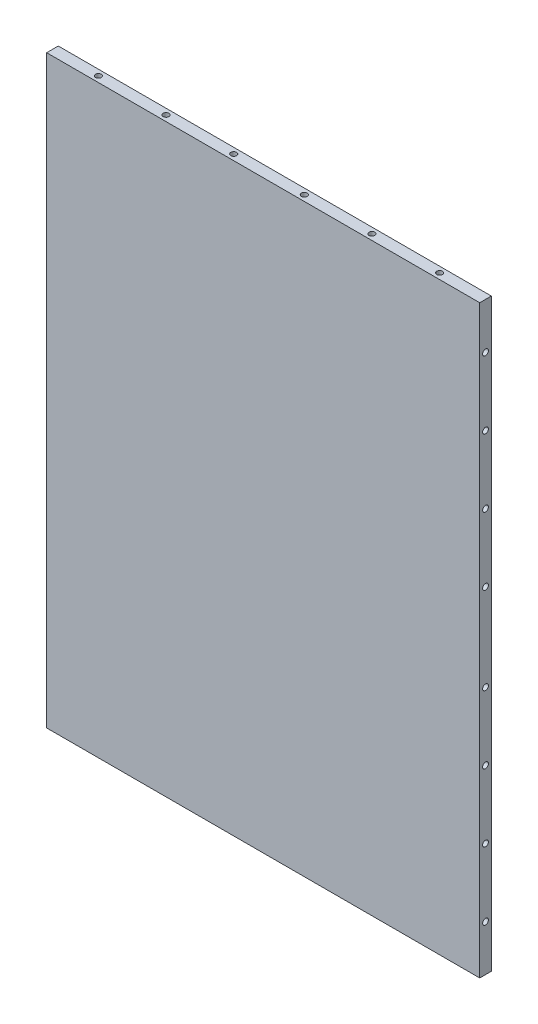
from build123d import *

# Parameters (mm, degrees)
CROQUIS1_W              = 448
CROQUIS1_H              = 605
SALIENTE_EXTRUIR2_DEPTH = 6
CORTAR_EXTRUIR2_START   = 225
CROQUIS3_R              = 3
CORTAR_EXTRUIR2_DEPTH   = 27
CORTAR_EXTRUIR3_START   = 303
CROQUIS4_R              = 3
CORTAR_EXTRUIR3_DEPTH   = 22


with BuildPart() as part:
    # Croquis1 → Saliente-Extruir2 (new, symmetric)
    with BuildSketch(Plane.XY):
        Rectangle(CROQUIS1_W, CROQUIS1_H)
    extrude(amount=SALIENTE_EXTRUIR2_DEPTH, both=True)

    # Croquis3 → Cortar-Extruir2 (cut)
    with BuildSketch(Plane(origin=(0, 0, 0), x_dir=(0, 0, -1), z_dir=(1, 0, 0)).offset(CORTAR_EXTRUIR2_START)):
        with Locations((0, 255)):
            Circle(CROQUIS3_R)
        with Locations((0, 185)):
            Circle(CROQUIS3_R)
        with Locations((0, 115)):
            Circle(CROQUIS3_R)
        with Locations((0, 45)):
            Circle(CROQUIS3_R)
        with Locations((0, -45)):
            Circle(CROQUIS3_R)
        with Locations((0, -115)):
            Circle(CROQUIS3_R)
        with Locations((0, -185)):
            Circle(CROQUIS3_R)
        with Locations((0, -255)):
            Circle(CROQUIS3_R)
    cortar_extruir2 = extrude(amount=-CORTAR_EXTRUIR2_DEPTH, mode=Mode.SUBTRACT)

    # Simetría1: Cortar-Extruir2 across plane
    add(cortar_extruir2.mirror(Plane(origin=(0, 0, 0), x_dir=(0, 0, 1), z_dir=(1, 0, 0))), mode=Mode.SUBTRACT)

    # Croquis4 → Cortar-Extruir3 (cut)
    with BuildSketch(Plane(origin=(0, 0, 0), x_dir=(1, 0, 0), z_dir=(0, 1, 0)).offset(CORTAR_EXTRUIR3_START)):
        with Locations((-176.5, 0)):
            Circle(CROQUIS4_R)
        with Locations((-106.5, 0)):
            Circle(CROQUIS4_R)
        with Locations((-36.5, 0)):
            Circle(CROQUIS4_R)
        with Locations((36.5, 0)):
            Circle(CROQUIS4_R)
        with Locations((106.5, 0)):
            Circle(CROQUIS4_R)
        with Locations((176.5, 0)):
            Circle(CROQUIS4_R)
    cortar_extruir3 = extrude(amount=-CORTAR_EXTRUIR3_DEPTH, mode=Mode.SUBTRACT)

    # Simetría2: Cortar-Extruir3 across plane
    add(cortar_extruir3.mirror(Plane.ZX), mode=Mode.SUBTRACT)


solid = part.part
